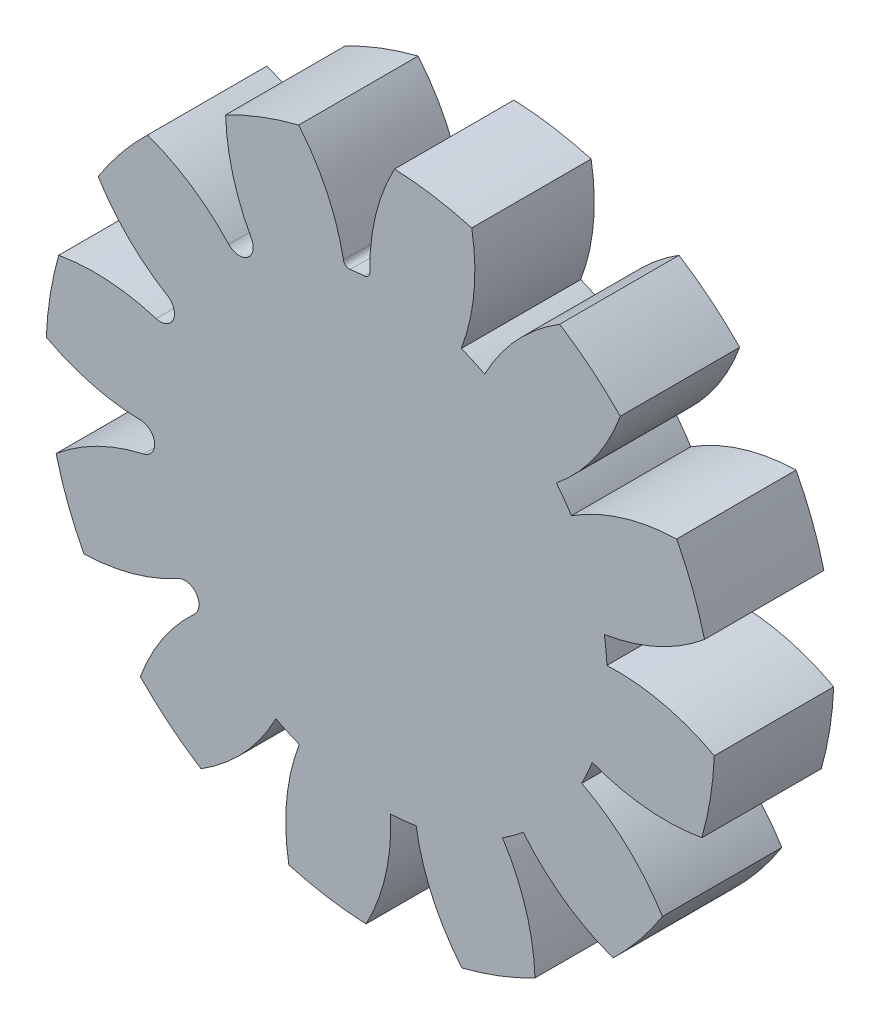
from build123d import *

# Parameters (mm, degrees)
SKETCH1_R           = 14
BOSS_EXTRUDE1_DEPTH = 2.5
CUT_EXTRUDE1_START  = 21.420577857
CUT_EXTRUDE1_DEPTH  = 26.420577857
FILLET1_R           = 0.25
CIRPATTERN1_COUNT   = 12
FILLET2_R           = 0.6
FILLET3_R           = 0.6
FILLET4_R           = 0.6
FILLET5_R           = 0.6


with BuildPart() as part:
    # Sketch1 → Boss-Extrude1 (new, symmetric)
    with BuildSketch(Plane.XY):
        Circle(SKETCH1_R)
    extrude(amount=BOSS_EXTRUDE1_DEPTH, both=True)

    # Sketch2 → Cut-Extrude1 (cut)
    with BuildSketch(Plane.XY.offset(2.5).offset(CUT_EXTRUDE1_START)):
        with BuildLine():
            ThreePointArc((-0.430438648, 9.490243546), (-0.222226767, 11.808448469), (0.596346311, 13.987293201))
            ThreePointArc((0.596346311, 13.987293201), (-1.425202617, 13.927268128), (-3.417009435, 13.576599225))
            ThreePointArc((-3.417009435, 13.576599225), (-2.174093588, 11.608710395), (-1.50066187, 9.380725662))
            ThreePointArc((-1.50066187, 9.380725662), (-0.967101776, 9.450646229), (-0.430438648, 9.490243546))
        make_face()
    cut_extrude1 = extrude(amount=-CUT_EXTRUDE1_DEPTH, mode=Mode.SUBTRACT)

    # Fillet1
    fillet1_edges = [part.edges().sort_by_distance(p)[0] for p in [
        (-1.50066187, 9.380725662, 0),
        (-0.430438648, 9.490243546, 0),
    ]]
    fillet(fillet1_edges, radius=FILLET1_R)

    # CirPattern1: Cut-Extrude1 ×12 about axis
    cirpattern1_axis = Axis((0, 0, 2.5), (0, 0, 1))
    for i in range(1, CIRPATTERN1_COUNT):
        add(cut_extrude1.rotate(cirpattern1_axis, i * 360 / CIRPATTERN1_COUNT), mode=Mode.SUBTRACT)

    # Fillet2
    # the kernel refuses this fillet: 0.6 mm, written as the material it adds along each edge
    with BuildSketch(Plane(origin=(-5.989974133, 7.373615794, 2.5), x_dir=(-0.6546840177965881, 0.7559026636027397, 0), z_dir=(0, 0, -1))) as fillet2_piece_1:
        with BuildLine():
            CenterArc((0.564611753, 0.599701652), FILLET2_R, 185.108089024, 83.084978973)
            ThreePointArc((-0.03300535, 0.546280701), (-0.012568085, 0.273378072), (0, 0))
            ThreePointArc((0, 0), (0.272846371, 0.004302723), (0.545692742, 0))
        make_face()
    extrude(amount=5)
    with BuildSketch(Plane(origin=(-5.117892577, 8.003572675, 2.5), x_dir=(-0.8266142951027914, -0.5627688754113143, 0), z_dir=(0, 0, -1))) as fillet2_piece_2:
        with BuildLine():
            CenterArc((0.564559284, 0.599751046), FILLET2_R, 185.264442517, 83.084978973)
            ThreePointArc((-0.032909815, 0.54469947), (-0.012160017, 0.272609225), (0, 0))
            ThreePointArc((0, 0), (0.273638428, 0.003941765), (0.547276857, 0))
        make_face()
    extrude(amount=5)

    # Fillet3
    # the kernel refuses this fillet: 0.6 mm, written as the material it adds along each edge
    with BuildSketch(Plane(origin=(-8.874277665, 3.390751529, 2.5), x_dir=(-0.9449243226648774, 0.3272889005700054, 0), z_dir=(0, 0, -1))) as fillet3_piece_1:
        with BuildLine():
            CenterArc((0.564611753, 0.599701652), FILLET3_R, 185.108089024, 83.084978973)
            ThreePointArc((-0.03300535, 0.546280701), (-0.012568085, 0.273378072), (0, 0))
            ThreePointArc((0, 0), (0.272846371, 0.004302723), (0.545692742, 0))
        make_face()
    extrude(amount=5)
    with BuildSketch(Plane(origin=(-8.434011323, 4.372350969, 2.5), x_dir=(-0.4344845409847307, -0.9006792901167916, 0), z_dir=(0, 0, -1))) as fillet3_piece_2:
        with BuildLine():
            CenterArc((0.564559284, 0.599751046), FILLET3_R, 185.264442517, 83.084978973)
            ThreePointArc((-0.032909815, 0.54469947), (-0.012160017, 0.272609225), (0, 0))
            ThreePointArc((0, 0), (0.273638428, 0.003941765), (0.547276857, 0))
        make_face()
    extrude(amount=5)

    # Fillet4
    # the kernel refuses this fillet: 0.6 mm, written as the material it adds along each edge
    with BuildSketch(Plane(origin=(-9.380725662, -1.50066187, 2.5), x_dir=(-0.9819729183665902, -0.18902165906213533, 0), z_dir=(0, 0, -1))) as fillet4_piece_1:
        with BuildLine():
            CenterArc((0.564611753, 0.599701652), FILLET4_R, 185.108089024, 83.084978973)
            ThreePointArc((-0.03300535, 0.546280701), (-0.012568085, 0.273378072), (0, 0))
            ThreePointArc((0, 0), (0.272846371, 0.004302723), (0.545692742, 0))
        make_face()
    extrude(amount=5)
    with BuildSketch(Plane(origin=(-9.490243546, -0.430438648, 2.5), x_dir=(0.07406499501400296, -0.997253416396041, 0), z_dir=(0, 0, -1))) as fillet4_piece_2:
        with BuildLine():
            CenterArc((0.564559284, 0.599751046), FILLET4_R, 185.264442517, 83.084978973)
            ThreePointArc((-0.032909815, 0.54469947), (-0.012160017, 0.272609225), (0, 0))
            ThreePointArc((0, 0), (0.273638428, 0.003941765), (0.547276857, 0))
        make_face()
    extrude(amount=5)

    # Fillet5
    # the kernel refuses this fillet: 0.6 mm, written as the material it adds along each edge
    with BuildSketch(Plane(origin=(-7.373615794, -5.989974133, 2.5), x_dir=(-0.7559026636027405, -0.6546840177965871, 0), z_dir=(0, 0, -1))) as fillet5_piece_1:
        with BuildLine():
            CenterArc((0.564611753, 0.599701652), FILLET5_R, 185.108089024, 83.084978973)
            ThreePointArc((-0.03300535, 0.546280701), (-0.012568085, 0.273378072), (0, 0))
            ThreePointArc((0, 0), (0.272846371, 0.004302723), (0.545692742, 0))
        make_face()
    extrude(amount=5)
    with BuildSketch(Plane(origin=(-8.003572675, -5.117892577, 2.5), x_dir=(0.562768875411312, -0.8266142951027928, 0), z_dir=(0, 0, -1))) as fillet5_piece_2:
        with BuildLine():
            CenterArc((0.564559284, 0.599751046), FILLET5_R, 185.264442517, 83.084978973)
            ThreePointArc((-0.032909815, 0.54469947), (-0.012160017, 0.272609225), (0, 0))
            ThreePointArc((0, 0), (0.273638428, 0.003941765), (0.547276857, 0))
        make_face()
    extrude(amount=5)


solid = part.part
